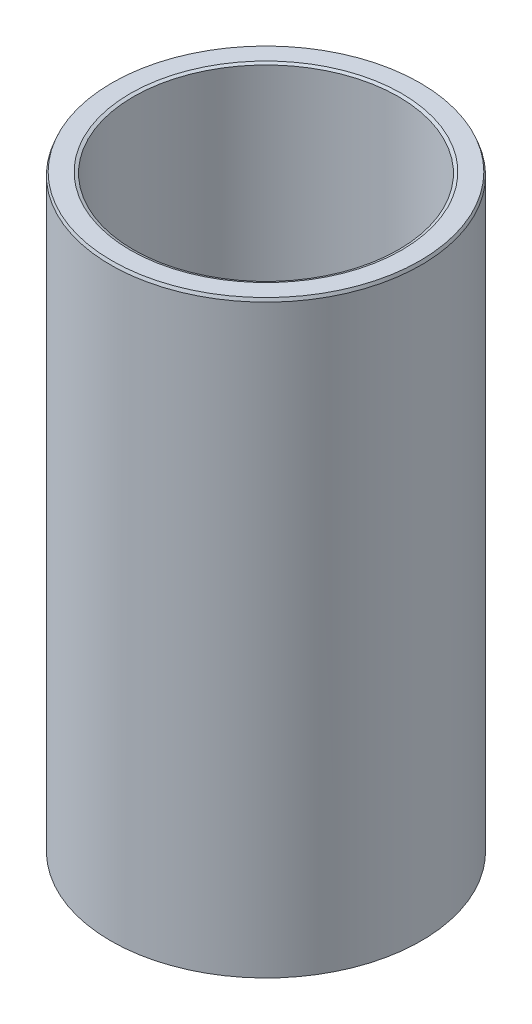
from build123d import *
from OCP.BRepFilletAPI import BRepFilletAPI_MakeChamfer

# Parameters (mm, degrees)
SKETCH1_R           = 35
BOSS_EXTRUDE1_DEPTH = 132.906049018
SKETCH2_R           = 29.882326043
CUT_EXTRUDE1_DEPTH  = 142.823897371
CHAMFER1_SIZE       = 0.702598258
CHAMFER1_SIZE2      = 0.274392454


with BuildPart() as part:
    # Sketch1 → Boss-Extrude1 (new body)
    with BuildSketch(Plane(origin=(0, 0, 0), x_dir=(1, 0, 0), z_dir=(0, 1, 0))):
        Circle(SKETCH1_R)
    extrude(amount=BOSS_EXTRUDE1_DEPTH)

    # Sketch2 → Cut-Extrude1 (cut, through all)
    with BuildSketch(Plane(origin=(0, 0, 0), x_dir=(1, 0, 0), z_dir=(0, 1, 0))):
        Circle(SKETCH2_R)
    extrude(amount=CUT_EXTRUDE1_DEPTH, mode=Mode.SUBTRACT)

    # Chamfer1: one chamfer whose edges measure the first distance from different faces: ONE call of the kernel's chamfer builder (chamfer() names one face for all edges)
    chamfer1_edges_1 = [part.edges().sort_by_distance(p)[0] for p in [
        (-29.882326043, 132.906049018, 0),
    ]]
    chamfer1_side_1 = [part.faces().sort_by_distance(p)[0] for p in [
        (-34.010050506, 132.906049018, 0),
    ]]
    chamfer1_edges_2 = [part.edges().sort_by_distance(p)[0] for p in [
        (-29.882326043, 0, 0),
    ]]
    chamfer1_side_2 = [part.faces().sort_by_distance(p)[0] for p in [
        (-29.882326043, 66.453024509, 0),
    ]]
    chamfer1_edges_3 = [part.edges().sort_by_distance(p)[0] for p in [
        (-35, 0, 0),
    ]]
    chamfer1_side_3 = [part.faces().sort_by_distance(p)[0] for p in [
        (-34.010050506, 0, 0),
    ]]
    chamfer1_edges_4 = [part.edges().sort_by_distance(p)[0] for p in [
        (-35, 132.906049018, 0),
    ]]
    chamfer1_side_4 = [part.faces().sort_by_distance(p)[0] for p in [
        (-35, 66.453024509, 0),
    ]]
    chamfer1 = BRepFilletAPI_MakeChamfer(part.part.solid().wrapped)
    for e in chamfer1_edges_1:
        chamfer1.Add(CHAMFER1_SIZE, CHAMFER1_SIZE2, e.wrapped, chamfer1_side_1[0].wrapped)  # the first distance lies on this face
    for e in chamfer1_edges_2:
        chamfer1.Add(CHAMFER1_SIZE, CHAMFER1_SIZE2, e.wrapped, chamfer1_side_2[0].wrapped)  # the first distance lies on this face
    for e in chamfer1_edges_3:
        chamfer1.Add(CHAMFER1_SIZE, CHAMFER1_SIZE2, e.wrapped, chamfer1_side_3[0].wrapped)  # the first distance lies on this face
    for e in chamfer1_edges_4:
        chamfer1.Add(CHAMFER1_SIZE, CHAMFER1_SIZE2, e.wrapped, chamfer1_side_4[0].wrapped)  # the first distance lies on this face
    add(Compound.cast(chamfer1.Shape()), mode=Mode.REPLACE)


solid = part.part
